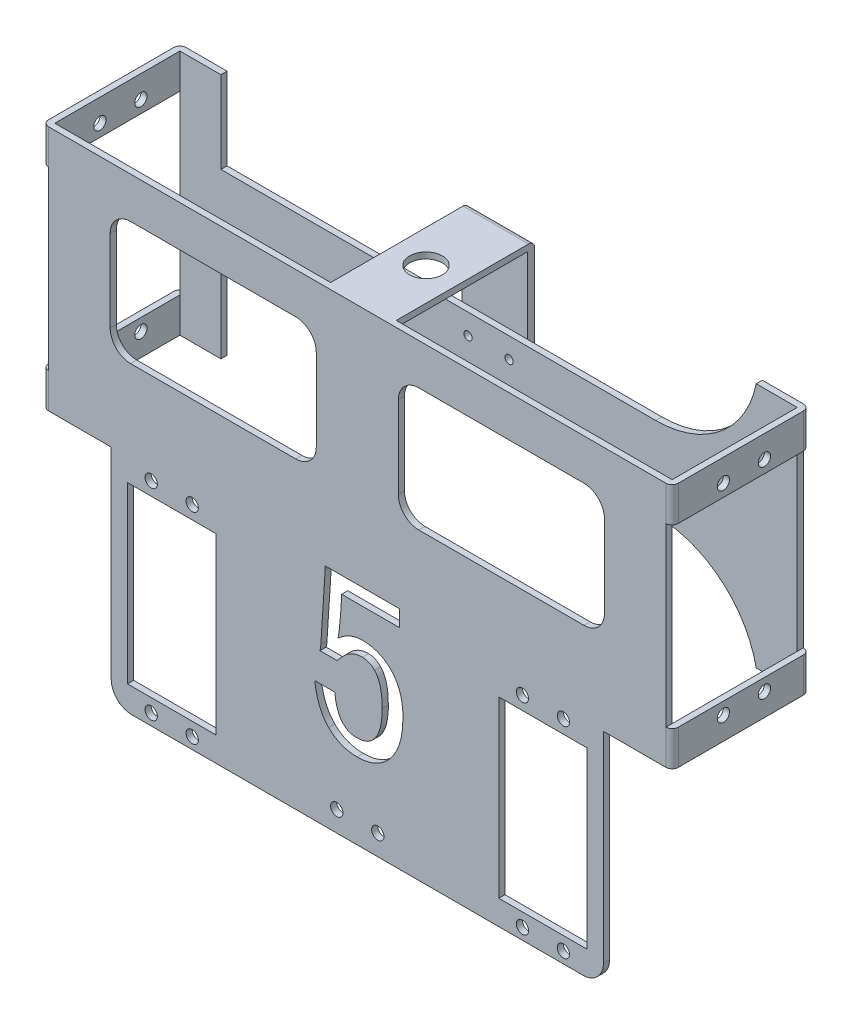
from build123d import *
from build123d.topology import SkipClean

# Parameters (mm, degrees)
SKETCH1_R            = 1.5
SKETCH1_W            = 21.5
SKETCH1_H            = 42.5
SKETCH1_W_2          = 50.25
SKETCH1_H_2          = 30
BOSS_EXTRUDE1_DEPTH  = 1.5
FILLET2_R            = 5
CUT_EXTRUDE1_DEPTH   = 1.5
BOSS_EXTRUDE4_START  = -1.5
SKETCH7_W            = 1.5
SKETCH7_H            = 8.5
BOSS_EXTRUDE4_DEPTH  = 33.5
CUT_EXTRUDE4_REACH   = 194.676
SKETCH8_R            = 1.5
SKETCH10_W           = 1.5
SKETCH10_H           = 60
BOSS_EXTRUDE5_DEPTH  = 10
SKETCH11_W           = 1.5
SKETCH11_H           = 20
BOSS_EXTRUDE6_DEPTH  = 65.25
CUT_EXTRUDE5_REACH   = 183.16
SKETCH12_R           = 1
FILLET3_R            = 1.5
FILLET4_R            = 25
FILLET3_OF_MIRROR3_R = 1.5
SKETCH13_W           = 16
SKETCH13_H           = 1.5
BOSS_EXTRUDE7_DEPTH  = 33.75
SKETCH14_W           = 16
SKETCH14_H           = 1.75
BOSS_EXTRUDE9_DEPTH  = 38.5
SKETCH16_R           = 1
CUT_EXTRUDE7_DEPTH   = 181.888259788
FILLET5_R            = 1.5
CUT_EXTRUDE8_REACH   = 183.206
SKETCH17_R           = 4


with BuildPart() as part:
    # Sketch1 → Boss-Extrude1 (new body)
    with BuildSketch(Plane.XY):
        Polygon((0, 0), (120, 0), (120, 54), (135.25, 54), (135.25, 114), (-15.25, 114), (-15.25, 54), (0, 54), align=None)
        with Locations((100.25, 51.75)):
            Circle(SKETCH1_R, mode=Mode.SUBTRACT)
        with Locations((110.25, 51.75)):
            Circle(SKETCH1_R, mode=Mode.SUBTRACT)
        with Locations((110.25, 2.75)):
            Circle(SKETCH1_R, mode=Mode.SUBTRACT)
        with Locations((100.25, 2.75)):
            Circle(SKETCH1_R, mode=Mode.SUBTRACT)
        with Locations((9.75, 2.75)):
            Circle(SKETCH1_R, mode=Mode.SUBTRACT)
        with Locations((19.75, 2.75)):
            Circle(SKETCH1_R, mode=Mode.SUBTRACT)
        with Locations((9.75, 51.75)):
            Circle(SKETCH1_R, mode=Mode.SUBTRACT)
        with Locations((19.75, 51.75)):
            Circle(SKETCH1_R, mode=Mode.SUBTRACT)
        with Locations((55, 5)):
            Circle(SKETCH1_R, mode=Mode.SUBTRACT)
        with Locations((65, 5)):
            Circle(SKETCH1_R, mode=Mode.SUBTRACT)
        with Locations((14.75, 27.25)):
            Rectangle(SKETCH1_W, SKETCH1_H, mode=Mode.SUBTRACT)
        with Locations((105.25, 27.25)):
            Rectangle(SKETCH1_W, SKETCH1_H, mode=Mode.SUBTRACT)
        with Locations((24.875, 89)):
            Rectangle(SKETCH1_W_2, SKETCH1_H_2, mode=Mode.SUBTRACT)
        with Locations((95.125, 89)):
            Rectangle(SKETCH1_W_2, SKETCH1_H_2, mode=Mode.SUBTRACT)
    extrude(amount=BOSS_EXTRUDE1_DEPTH)

    # Fillet2
    fillet2_edges = [part.edges().sort_by_distance(p)[0] for p in [
        (70, 104, 0.75),
        (70, 74, 0.75),
        (120.25, 74, 0.75),
        (120.25, 104, 0.75),
        (120, 0, 0.75),
        (0, 0, 0.75),
        (50, 74, 0.75),
        (50, 104, 0.75),
        (-0.25, 104, 0.75),
        (-0.25, 74, 0.75),
    ]]
    fillet(fillet2_edges, radius=FILLET2_R)

    # Sketch3 → Cut-Extrude1 (cut)
    with BuildSketch(Plane.XY.offset(1.5)):
        with BuildLine():
            Line((52.168781631, 55.014250106), (70.288653735, 55.014250106))
            Line((70.288653735, 55.014250106), (70.288653735, 51.026629674))
            Line((70.288653735, 51.026629674), (56.172009189, 51.026629674))
            Line((56.172009189, 51.026629674), (56.172009189, 50.378933987))
            add(Edge.make_bspline(
                [(56.172009189, 50.378933987), (56.092866584, 49.061977686), (55.936439337, 46.458982123), (55.671042783, 43.86484012), (55.539920627, 42.583175058)],
                knots=[0, 0, 0, 0, 1.011877484, 2, 2, 2, 2], degree=3))
            add(Edge.make_bspline(
                [(55.539920627, 42.583175058), (55.479454515, 42.373877169), (55.360066473, 41.960626437), (55.339416086, 41.531021912), (55.32922444, 41.318997935)],
                knots=[0, 0, 0, 0, 1.012934151, 2, 2, 2, 2], degree=3))
            add(Edge.make_bspline(
                [(55.32922444, 41.318997935), (55.557889375, 41.520073449), (56.004614378, 41.912899135), (56.708538891, 42.432949342), (57.433432376, 42.861729216), (58.163247262, 43.226027806), (58.913748299, 43.497623496), (59.671638536, 43.706065933), (60.447240745, 43.824116097), (60.968229701, 43.839606949), (61.228717683, 43.847352182)],
                knots=[0, 0, 0, 0, 1.111435192, 2.171324999, 3.189242381, 4.183086183, 5.144550894, 6.09824559, 7.049146506, 8, 8, 8, 8], degree=3))
            add(Edge.make_bspline(
                [(61.228717683, 43.847352182), (61.57260167, 43.841710138), (62.247475399, 43.830637605), (63.233574614, 43.68885704), (64.179389886, 43.484062624), (65.074630679, 43.177103927), (65.926862995, 42.791105792), (66.734755974, 42.325028343), (67.48735187, 41.756338059), (67.948663138, 41.325790408), (68.181691863, 41.108301747)],
                knots=[0, 0, 0, 0, 1.073982058, 2.107694181, 3.107733017, 4.095032409, 5.059264593, 6.028420199, 7.004067844, 8, 8, 8, 8], degree=3))
            add(Edge.make_bspline(
                [(68.181691863, 41.108301747), (68.420624772, 40.854270379), (68.899660991, 40.344963284), (69.489729395, 39.462125244), (69.999305893, 38.505383695), (70.423795179, 37.463641451), (70.739562989, 36.334290187), (70.962974415, 35.122263721), (71.107052287, 33.825831202), (71.123151777, 32.930567152), (71.131438484, 32.46975807)],
                knots=[0, 0, 0, 0, 0.891957799, 1.788284801, 2.709332597, 3.665754462, 4.663344109, 5.707465136, 6.819989605, 8, 8, 8, 8], degree=3))
            add(Edge.make_bspline(
                [(71.131438484, 32.46975807), (71.11870304, 31.889301585), (71.093973457, 30.76217586), (70.92443588, 29.122179162), (70.628803166, 27.589547386), (70.218215551, 26.157521472), (69.677387682, 24.835814775), (69.02709087, 23.613613483), (68.25712049, 22.494308563), (67.64397085, 21.83939774), (67.338907114, 21.513556332)],
                knots=[0, 0, 0, 0, 1.170293337, 2.272466172, 3.31954465, 4.313707029, 5.271068876, 6.193190459, 7.101048044, 8, 8, 8, 8], degree=3))
            add(Edge.make_bspline(
                [(67.338907114, 21.513556332), (67.092123832, 21.275511153), (66.603869082, 20.804544526), (65.781090459, 20.218305857), (64.929709157, 19.701765094), (64.024236962, 19.290467156), (63.07838149, 18.955729846), (62.07931025, 18.736600061), (61.038051572, 18.588636416), (60.326643206, 18.572183929), (59.96454056, 18.563809711)],
                knots=[0, 0, 0, 0, 1.007140329, 1.992602766, 2.963525238, 3.932275081, 4.912168459, 5.908793113, 6.935588077, 8, 8, 8, 8], degree=3))
            add(Edge.make_bspline(
                [(59.96454056, 18.563809711), (59.620656573, 18.569451754), (58.945782844, 18.580524287), (57.959683629, 18.722304852), (57.013868356, 18.927099268), (56.118627564, 19.234057966), (55.266395248, 19.6200561), (54.458502269, 20.086133549), (53.705906373, 20.654823834), (53.244595104, 21.085371485), (53.01156638, 21.302860145)],
                knots=[0, 0, 0, 0, 1.073982058, 2.107694181, 3.107733017, 4.095032409, 5.059264593, 6.028420199, 7.004067844, 8, 8, 8, 8], degree=3))
            add(Edge.make_bspline(
                [(53.01156638, 21.302860145), (52.787388481, 21.539940558), (52.333839881, 22.019593055), (51.747976382, 22.842260159), (51.236751154, 23.750991381), (50.781689238, 24.739892181), (50.393303033, 25.813327586), (50.065874428, 26.970695206), (49.806844576, 28.214612328), (49.696919525, 29.076879399), (49.640427384, 29.520011448)],
                knots=[0, 0, 0, 0, 0.864668706, 1.749366381, 2.67021261, 3.627259696, 4.633506019, 5.694985373, 6.81541823, 8, 8, 8, 8], degree=3))
            Line((49.640427384, 29.520011448), (54.486439691, 29.520011448))
            add(Edge.make_bspline(
                [(54.486439691, 29.520011448), (54.524308238, 29.196914656), (54.597286114, 28.574262891), (54.763572386, 27.680947244), (54.961411352, 26.857511716), (55.212635118, 26.110690211), (55.492108354, 25.432694935), (55.811371457, 24.825958138), (56.177065275, 24.29230341), (56.457341418, 23.981899886), (56.593401564, 23.831214392)],
                knots=[0, 0, 0, 0, 1.263825863, 2.435565507, 3.528996689, 4.55188907, 5.494298936, 6.376103402, 7.21167886, 8, 8, 8, 8], degree=3))
            add(Edge.make_bspline(
                [(56.593401564, 23.831214392), (56.80933409, 23.635605109), (57.234846662, 23.250141137), (58.012451715, 22.86106703), (58.855877114, 22.606118612), (59.450148497, 22.580254725), (59.753844372, 22.567037269)],
                knots=[0, 0, 0, 0, 0.996633109, 1.963946445, 2.959497151, 4, 4, 4, 4], degree=3))
            add(Edge.make_bspline(
                [(59.753844372, 22.567037269), (60.156373461, 22.583403486), (60.924856566, 22.614648835), (62.010873385, 22.896035333), (62.978515291, 23.351358486), (63.498491256, 23.812558703), (63.75707193, 24.041910579)],
                knots=[0, 0, 0, 0, 1.101567696, 2.103043448, 3.056655812, 4, 4, 4, 4], degree=3))
            add(Edge.make_bspline(
                [(63.75707193, 24.041910579), (63.945660076, 24.247461242), (64.329211782, 24.66551142), (64.795648116, 25.407763459), (65.192241066, 26.23880025), (65.521962399, 27.166585084), (65.76648273, 28.195406046), (65.943287096, 29.322515422), (66.052539116, 30.547952975), (66.067162182, 31.39783433), (66.07472999, 31.837669508)],
                knots=[0, 0, 0, 0, 0.801927281, 1.63096454, 2.512104106, 3.450330232, 4.460467478, 5.552803927, 6.733513903, 8, 8, 8, 8], degree=3))
            add(Edge.make_bspline(
                [(66.07472999, 31.837669508), (66.068483678, 32.259208778), (66.056478421, 33.069396758), (65.972962738, 34.231880958), (65.829167963, 35.28898223), (65.617385568, 36.238085395), (65.357802389, 37.088332664), (65.029239897, 37.83077962), (64.654015133, 38.479954048), (64.33305526, 38.831848984), (64.178464305, 39.001339875)],
                knots=[0, 0, 0, 0, 1.334439276, 2.564759058, 3.687409163, 4.708321352, 5.640706759, 6.496053198, 7.275621056, 8, 8, 8, 8], degree=3))
            add(Edge.make_bspline(
                [(64.178464305, 39.001339875), (63.96693107, 39.195218005), (63.554768641, 39.572980305), (62.828202014, 39.97661493), (62.045696827, 40.222755287), (61.50363848, 40.2511273), (61.228717683, 40.265516998)],
                knots=[0, 0, 0, 0, 1.041864769, 2.030023865, 3.000868798, 4, 4, 4, 4], degree=3))
            add(Edge.make_bspline(
                [(61.228717683, 40.265516998), (61.020333413, 40.259060002), (60.609595771, 40.246332882), (60.002601615, 40.158809017), (59.415901282, 40.011826694), (58.852741861, 39.797879123), (58.307413917, 39.531440395), (57.786160691, 39.198975469), (57.273286856, 38.819856682), (56.962259214, 38.521148285), (56.804097751, 38.369251313)],
                knots=[0, 0, 0, 0, 1.011099367, 1.992936263, 2.969566165, 3.94022274, 4.911207572, 5.909380703, 6.936893825, 8, 8, 8, 8], degree=3))
            add(Edge.make_bspline(
                [(56.804097751, 38.369251313), (56.610421053, 38.172674032), (56.252652301, 37.809547187), (55.779453927, 37.296749165), (55.401594149, 36.86808356), (55.205231523, 36.594004384), (55.118528253, 36.472985628)],
                knots=[0, 0, 0, 0, 1.30355706, 2.407992224, 3.297054214, 4, 4, 4, 4], degree=3))
            Line((55.118528253, 36.472985628), (50.904604508, 36.472985628))
            add(Edge.make_bspline(
                [(50.904604508, 36.472985628), (50.964915922, 36.734559327), (51.0769378, 37.220403964), (51.103184805, 37.718111817), (51.115300695, 37.947858938)],
                knots=[0, 0, 0, 0, 1.076779202, 2, 2, 2, 2], degree=3))
            Line((51.115300695, 37.947858938), (52.168781631, 54.171465357))
            Line((52.168781631, 54.171465357), (52.168781631, 55.014250106))
        make_face()
    extrude(amount=-CUT_EXTRUDE1_DEPTH, mode=Mode.SUBTRACT)

    # Sketch7 → Boss-Extrude4 (add)
    with BuildSketch(Plane(origin=(0, 0, 0), x_dir=(-1, 0, 0), z_dir=(0, 0, -1)).offset(BOSS_EXTRUDE4_START)):
        with Locations((-136, 109.75)):
            Rectangle(SKETCH7_W, SKETCH7_H)
        with Locations((-136, 58.25)):
            Rectangle(SKETCH7_W, SKETCH7_H)
    boss_extrude4 = extrude(amount=BOSS_EXTRUDE4_DEPTH)

    # Sketch8 → Cut-Extrude4 (cut, up to next)
    with BuildSketch(Plane(origin=(136.75, 0, 0), x_dir=(0, 0, -1), z_dir=(1, 0, 0)), mode=Mode.PRIVATE) as cut_extrude4_sk1:
        with Locations(Location((11, 108.5, 0), (0, 0, 90))):
            Circle(SKETCH8_R)
    cut_extrude4_tool1 = extrude(cut_extrude4_sk1.sketch, amount=-CUT_EXTRUDE4_REACH, mode=Mode.PRIVATE) & part.part
    # Sketch8 → Cut-Extrude4 (cut, up to next)
    with BuildSketch(Plane(origin=(136.75, 0, 0), x_dir=(0, 0, -1), z_dir=(1, 0, 0)), mode=Mode.PRIVATE) as cut_extrude4_sk2:
        with Locations(Location((21, 108.5, 0), (0, 0, 90))):
            Circle(SKETCH8_R)
    cut_extrude4_tool2 = extrude(cut_extrude4_sk2.sketch, amount=-CUT_EXTRUDE4_REACH, mode=Mode.PRIVATE) & part.part
    # Sketch8 → Cut-Extrude4 (cut, up to next)
    with BuildSketch(Plane(origin=(136.75, 0, 0), x_dir=(0, 0, -1), z_dir=(1, 0, 0)), mode=Mode.PRIVATE) as cut_extrude4_sk3:
        with Locations((21, 59.5)):
            Circle(SKETCH8_R)
    cut_extrude4_tool3 = extrude(cut_extrude4_sk3.sketch, amount=-CUT_EXTRUDE4_REACH, mode=Mode.PRIVATE) & part.part
    # Sketch8 → Cut-Extrude4 (cut, up to next)
    with BuildSketch(Plane(origin=(136.75, 0, 0), x_dir=(0, 0, -1), z_dir=(1, 0, 0)), mode=Mode.PRIVATE) as cut_extrude4_sk4:
        with Locations((11, 59.5)):
            Circle(SKETCH8_R)
    cut_extrude4_tool4 = extrude(cut_extrude4_sk4.sketch, amount=-CUT_EXTRUDE4_REACH, mode=Mode.PRIVATE) & part.part
    cut_extrude4_1 = cut_extrude4_tool1.solids().sort_by_distance((136.75, 108.5, -11))[0]
    add(cut_extrude4_1, mode=Mode.SUBTRACT)
    cut_extrude4_2 = cut_extrude4_tool2.solids().sort_by_distance((136.75, 108.5, -21))[0]
    add(cut_extrude4_2, mode=Mode.SUBTRACT)
    cut_extrude4_3 = cut_extrude4_tool3.solids().sort_by_distance((136.75, 59.5, -21))[0]
    add(cut_extrude4_3, mode=Mode.SUBTRACT)
    cut_extrude4_4 = cut_extrude4_tool4.solids().sort_by_distance((136.75, 59.5, -11))[0]
    add(cut_extrude4_4, mode=Mode.SUBTRACT)
    cut_extrude4 = cut_extrude4_1 + cut_extrude4_2 + cut_extrude4_3 + cut_extrude4_4  # Cut-Extrude4 as one shape, for the pattern or mirror that repeats it

    # Sketch10 → Boss-Extrude5 (add)
    with BuildSketch(Plane.ZY.offset(-135.25)):
        with Locations((-31.25, 84)):
            Rectangle(SKETCH10_W, SKETCH10_H)
    boss_extrude5 = extrude(amount=BOSS_EXTRUDE5_DEPTH)

    # Sketch11 → Boss-Extrude6 (add)
    with BuildSketch(Plane.ZY.offset(-125.25)):
        with Locations((-31.25, 84)):
            Rectangle(SKETCH11_W, SKETCH11_H)
    boss_extrude6 = extrude(amount=BOSS_EXTRUDE6_DEPTH)

    # Sketch12 → Cut-Extrude5 (cut, up to next)
    with BuildSketch(Plane(origin=(0, 0, -32), x_dir=(-1, 0, 0), z_dir=(0, 0, -1)), mode=Mode.PRIVATE) as cut_extrude5_sk1:
        with Locations((-65, 89)):
            Circle(SKETCH12_R)
    cut_extrude5_tool1 = extrude(cut_extrude5_sk1.sketch, amount=-CUT_EXTRUDE5_REACH, mode=Mode.PRIVATE) & part.part
    # Sketch12 → Cut-Extrude5 (cut, up to next)
    with BuildSketch(Plane(origin=(0, 0, -32), x_dir=(-1, 0, 0), z_dir=(0, 0, -1)), mode=Mode.PRIVATE) as cut_extrude5_sk2:
        with Locations((-65, 79)):
            Circle(SKETCH12_R)
    cut_extrude5_tool2 = extrude(cut_extrude5_sk2.sketch, amount=-CUT_EXTRUDE5_REACH, mode=Mode.PRIVATE) & part.part
    cut_extrude5_1 = cut_extrude5_tool1.solids().sort_by_distance((65, 89, -32))[0]
    add(cut_extrude5_1, mode=Mode.SUBTRACT)
    cut_extrude5_2 = cut_extrude5_tool2.solids().sort_by_distance((65, 79, -32))[0]
    add(cut_extrude5_2, mode=Mode.SUBTRACT)
    cut_extrude5 = cut_extrude5_1 + cut_extrude5_2  # Cut-Extrude5 as one shape, for the pattern or mirror that repeats it

    # Fillet3
    fillet3_edges = [part.edges().sort_by_distance(p)[0] for p in [
        (136.75, 58.25, 1.5),
        (136.75, 58.25, -32),
        (136.75, 109.75, -32),
        (136.75, 109.75, 1.5),
    ]]
    fillet(fillet3_edges, radius=FILLET3_R)

    # Fillet4
    # the kernel refuses this fillet: 25 mm, written as the material it adds along each edge
    with BuildSketch(Plane(origin=(125.25, 74, -30.5), x_dir=(0, -1, 0), z_dir=(0, 0, -1)), Plane(origin=(125.25, 94, -32), x_dir=(0, 1, 0), z_dir=(0, 0, 1))) as fillet4_piece_1:
        with BuildLine():
            CenterArc((25, 24.494897428), FILLET4_R, 180, 78.463040967)
            Line((0, 24.494897428), (-0.5, 24.494897428))
            Line((-0.5, 24.494897428), (-0.5, 0))
            Line((-0.5, 0), (0, -0.5))
            ThreePointArc((0, -0.5), (10, -0.5), (19.9, -0.489897949))
            Line((19.9, -0.489897949), (20, 0))
        make_face()
    extrude(amount=1.5)

    # Mirror3: Boss-Extrude4, Cut-Extrude4, Boss-Extrude5, Boss-Extrude6, Cut-Extrude5 across plane
    add(boss_extrude4.mirror(Plane(origin=(60, 0, 0), x_dir=(0, 0, 1), z_dir=(1, 0, 0))))
    add(cut_extrude4.mirror(Plane(origin=(60, 0, 0), x_dir=(0, 0, 1), z_dir=(1, 0, 0))), mode=Mode.SUBTRACT)
    add(boss_extrude5.mirror(Plane(origin=(60, 0, 0), x_dir=(0, 0, 1), z_dir=(1, 0, 0))))
    add(boss_extrude6.mirror(Plane(origin=(60, 0, 0), x_dir=(0, 0, 1), z_dir=(1, 0, 0))))
    add(cut_extrude5.mirror(Plane(origin=(60, 0, 0), x_dir=(0, 0, 1), z_dir=(1, 0, 0))), mode=Mode.SUBTRACT)

    # Fillet3 of Mirror3
    fillet3_of_mirror3_edges = [part.edges().sort_by_distance(p)[0] for p in [
        (-16.75, 58.25, 1.5),
        (-16.75, 58.25, -32),
        (-16.75, 109.75, -32),
        (-16.75, 109.75, 1.5),
    ]]
    fillet(fillet3_of_mirror3_edges, radius=FILLET3_OF_MIRROR3_R)

    # Sketch13 → Boss-Extrude7 (add)
    with BuildSketch(Plane(origin=(0, 0, 0), x_dir=(-1, 0, 0), z_dir=(0, 0, -1))):
        with Locations((-60, 113.25)):
            Rectangle(SKETCH13_W, SKETCH13_H)
    extrude(amount=BOSS_EXTRUDE7_DEPTH)

    # Sketch14 → Boss-Extrude9 (add)
    with BuildSketch(Plane.XZ.offset(-112.5)):
        with Locations((60, -32.875)):
            Rectangle(SKETCH14_W, SKETCH14_H)
    extrude(amount=BOSS_EXTRUDE9_DEPTH)

    # Sketch16 → Cut-Extrude7 (cut, through all)
    with SkipClean():  # the faces are left unmerged after this step: merging them gives an invalid solid
        with BuildSketch(Plane.XY.offset(-30.5)):
            with Locations(Location((55, 89, 0), (0, 0, 90))):
                Circle(SKETCH16_R)
            with Locations(Location((65, 89, 0), (0, 0, 90))):
                Circle(SKETCH16_R)
            with Locations(Location((65, 79, 0), (0, 0, 90))):
                Circle(SKETCH16_R)
            with Locations(Location((55, 79, 0), (0, 0, 90))):
                Circle(SKETCH16_R)
        extrude(amount=-CUT_EXTRUDE7_DEPTH, mode=Mode.SUBTRACT)

    # Fillet5
    fillet5_edges = [part.edges().sort_by_distance(p)[0] for p in [
        (60, 114, -33.75),
    ]]
    fillet(fillet5_edges, radius=FILLET5_R)

    # Sketch17 → Cut-Extrude8 (cut, up to next)
    with BuildSketch(Plane(origin=(0, 114, 0), x_dir=(1, 0, 0), z_dir=(0, 1, 0)), mode=Mode.PRIVATE) as cut_extrude8_sk1:
        with Locations(Location((60, 15.25, 0), (0, 0, 180))):
            Circle(SKETCH17_R)
    cut_extrude8_tool1 = extrude(cut_extrude8_sk1.sketch, amount=-CUT_EXTRUDE8_REACH, mode=Mode.PRIVATE) & part.part
    add(cut_extrude8_tool1.solids().sort_by_distance((60, 114, -15.25))[0], mode=Mode.SUBTRACT)


solid = part.part
